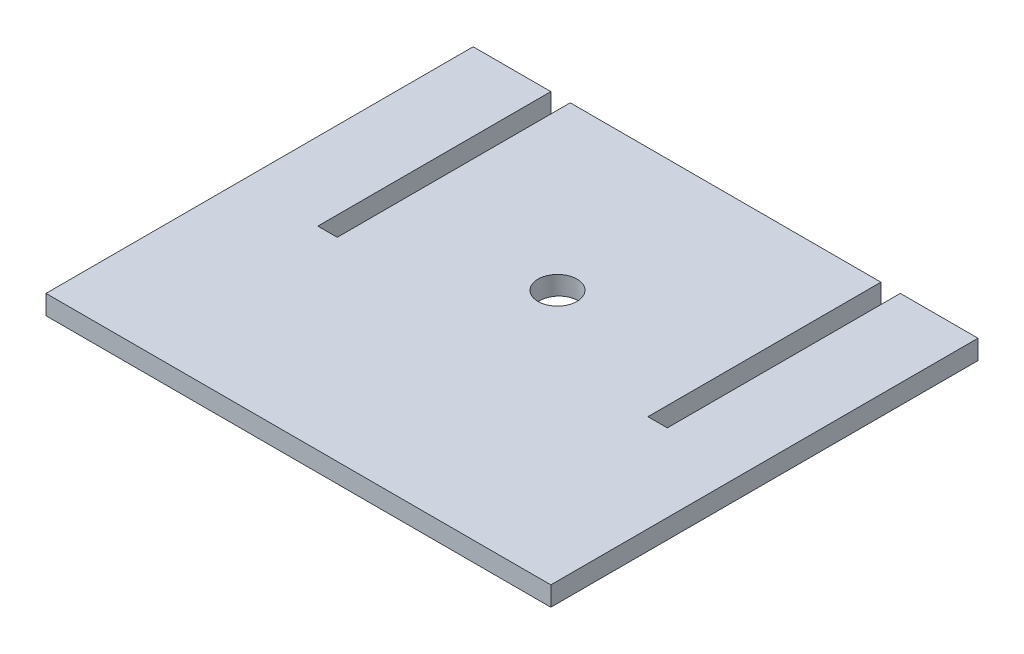
from build123d import *

# Parameters (mm, degrees)
SKETCH1_W           = 330.2
SKETCH1_H           = 279.4
BOSS_EXTRUDE1_DEPTH = 6.35
SKETCH2_W           = 12.7
SKETCH2_H           = 152.4
CUT_EXTRUDE1_DEPTH  = 217.645770787
CAVITY1_START       = -5.196816792
CAVITY1_OUTLINE_R   = 12.7
CAVITY1_DEPTH       = 14.479849691


# Read off the part's stored shape, not the designer's step: Cavity1
with BuildPart() as part:
    # Sketch1 → Boss-Extrude1 (new, symmetric)
    with BuildSketch(Plane(origin=(0, 0, 0), x_dir=(1, 0, 0), z_dir=(0, 1, 0))):
        Rectangle(SKETCH1_W, SKETCH1_H)
    extrude(amount=BOSS_EXTRUDE1_DEPTH, both=True)

    # Sketch2 → Cut-Extrude1 (cut, through all)
    with BuildSketch(Plane(origin=(0, 6.35, 0), x_dir=(1, 0, 0), z_dir=(0, 1, 0))):
        with Locations((-107.95, 63.5)):
            Rectangle(SKETCH2_W, SKETCH2_H)
        with Locations((107.95, 63.5)):
            Rectangle(SKETCH2_W, SKETCH2_H)
    extrude(amount=-CUT_EXTRUDE1_DEPTH, mode=Mode.SUBTRACT)

    # Cavity1 outline → Cavity1 (cut)
    with BuildSketch(Plane(origin=(0, 0, 0), x_dir=(0.9999894493458413, 0.00458279136333027, 0.00031499257366167274), z_dir=(0.004593603922986451, -0.9976356448477001, -0.06857126900030612)).offset(CAVITY1_START)):
        with Locations((0.440476058, -29.695196787)):
            Circle(CAVITY1_OUTLINE_R)
    extrude(amount=CAVITY1_DEPTH, mode=Mode.SUBTRACT)


solid = part.part
